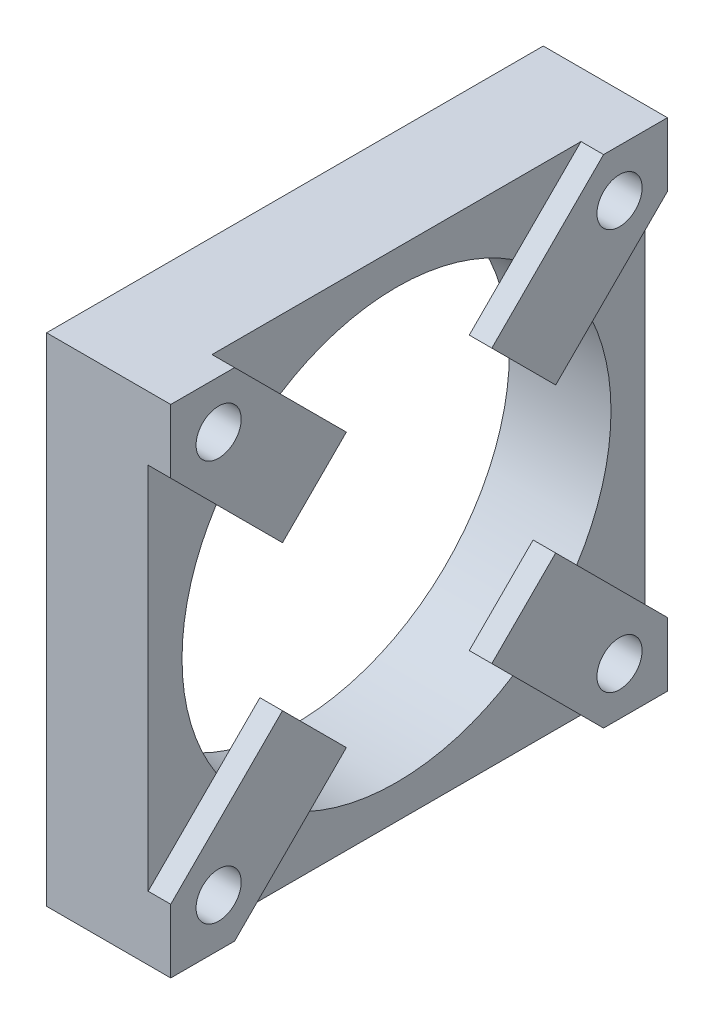
from build123d import *

# Parameters (mm, degrees)
SKETCH1_W               = 55.88
SKETCH1_H               = 55.88
SKETCH1_R               = 24.13
BOSS_EXTRUDE1_DEPTH     = 11.43
BOSS_EXTRUDE2_DEPTH     = 2.54
CIRPATTERN1_COUNT       = 4
CUT_EXTRUDE2_DEPTH      = 42.91
CUT_EXTRUDE2_DEPTH_BACK = 42.91
SKETCH5_R               = 2.54


with BuildPart() as part:
    # Sketch1 → Boss-Extrude1 (new body)
    with BuildSketch(Plane(origin=(0, 0, 0), x_dir=(0, 0, -1), z_dir=(1, 0, 0))):
        Rectangle(SKETCH1_W, SKETCH1_H)
        Circle(SKETCH1_R, mode=Mode.SUBTRACT)
    extrude(amount=BOSS_EXTRUDE1_DEPTH)

    # Sketch2 → Boss-Extrude2 (add)
    with BuildSketch(Plane(origin=(11.43, 0, 0), x_dir=(0, 0, -1), z_dir=(1, 0, 0))):
        Polygon((-27.94, 20.755795103), (-27.94, 27.94), (-20.755795103, 27.94), (-8.183436534, 15.367641431), (-15.367641431, 8.183436534), align=None)
    boss_extrude2 = extrude(amount=BOSS_EXTRUDE2_DEPTH)

    # CirPattern1: Boss-Extrude2 ×4 about axis
    cirpattern1_axis = Axis((11.43, 0, 0), (1, 0, 0))
    for i in range(1, CIRPATTERN1_COUNT):
        add(boss_extrude2.rotate(cirpattern1_axis, i * 360 / CIRPATTERN1_COUNT))

    # Sketch5 → Cut-Extrude2 (cut, two sides: drawn at the far end of the back side and taken through both)
    with BuildSketch(Plane(origin=(0, 0, 0), x_dir=(0, 0, -1), z_dir=(1, 0, 0)).offset(-CUT_EXTRUDE2_DEPTH_BACK)):
        with Locations((-22.551846327, -22.551846327)):
            Circle(SKETCH5_R)
        with Locations((-22.551846327, 22.551846327)):
            Circle(SKETCH5_R)
        with Locations((22.551846327, 22.551846327)):
            Circle(SKETCH5_R)
        with Locations((22.551846327, -22.551846327)):
            Circle(SKETCH5_R)
    extrude(amount=CUT_EXTRUDE2_DEPTH + CUT_EXTRUDE2_DEPTH_BACK, mode=Mode.SUBTRACT)


solid = part.part
